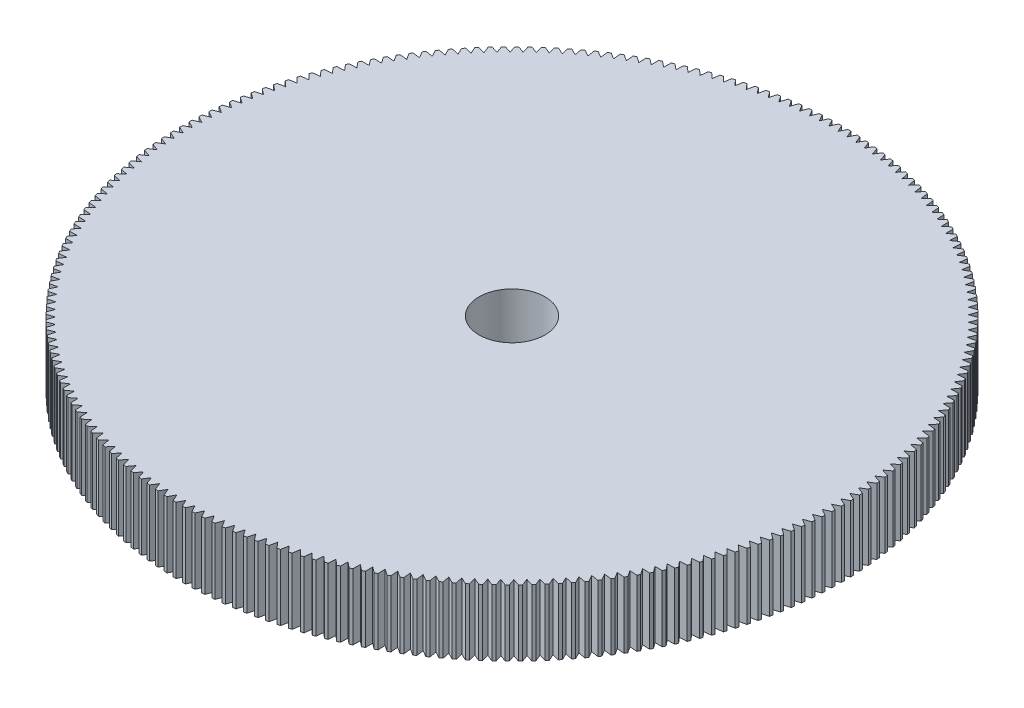
from build123d import *

# Parameters (mm, degrees)
Y_KSEKLIK_EKSTR_ZYON3_DEPTH = 5
IZIM3_R                     = 2.5
KES_EKSTR_ZYON1_DEPTH       = 10


with BuildPart() as part:
    # Çizim2 → Yükseklik-Ekstrüzyon3 (new body)
    with BuildSketch(Plane(origin=(0, 0, 0), x_dir=(1, 0, 0), z_dir=(0, 1, 0))):
        with BuildLine():
            Line((-15.953265986, 19.173059118), (-15.817862562, 18.633730827))
            Line((-15.817862562, 18.633730827), (-16.3280455, 18.854915054))
            ThreePointArc((-16.3280455, 18.854915054), (-16.411316906, 18.782480373), (-16.494266979, 18.709677933))
            Line((-16.494266979, 18.709677933), (-16.343517688, 18.174436171))
            Line((-16.343517688, 18.174436171), (-16.859808718, 18.380961388))
            ThreePointArc((-16.859808718, 18.380961388), (-16.940977717, 18.306178344), (-17.021815013, 18.231036867))
            Line((-17.021815013, 18.231036867), (-16.855842807, 17.700318184))
            Line((-16.855842807, 17.700318184), (-17.377820834, 17.892015946))
            ThreePointArc((-17.377820834, 17.892015946), (-17.456821223, 17.814945533), (-17.535479809, 17.737526305))
            Line((-17.535479809, 17.737526305), (-17.354420058, 17.211763564))
            Line((-17.354420058, 17.211763564), (-17.88165935, 17.388477519))
            ThreePointArc((-17.88165935, 17.388477519), (-17.958426696, 17.309182597), (-18.034842417, 17.229548763))
            Line((-18.034842417, 17.229548763), (-17.838842796, 16.709170783))
            Line((-17.838842796, 16.709170783), (-18.370913329, 16.870756801))
            ThreePointArc((-18.370913329, 16.870756801), (-18.445385018, 16.789302043), (-18.519495548, 16.707518553))
            Line((-18.519495548, 16.707518553), (-18.308715918, 16.192949762))
            Line((-18.308715918, 16.192949762), (-18.845183727, 16.339276051))
            ThreePointArc((-18.845183727, 16.339276051), (-18.91729902, 16.255727894), (-18.989043914, 16.171861451))
            Line((-18.989043914, 16.171861451), (-18.763656188, 15.66352154))
            Line((-18.763656188, 15.66352154), (-19.304083722, 15.794468753))
            ThreePointArc((-19.304083722, 15.794468753), (-19.373783801, 15.70889534), (-19.443104542, 15.623014348))
            Line((-19.443104542, 15.623014348), (-19.203292551, 15.121317924))
            Line((-19.203292551, 15.121317924), (-19.747239031, 15.23677926))
            ThreePointArc((-19.747239031, 15.23677926), (-19.814467046, 15.149250385), (-19.881307096, 15.06142489))
            Line((-19.881307096, 15.06142489), (-19.627266433, 14.566781145))
            Line((-19.627266433, 14.566781145), (-20.174288207, 14.666662432))
            ThreePointArc((-20.174288207, 14.666662432), (-20.238989328, 14.577249485), (-20.303294171, 14.487551117))
            Line((-20.303294171, 14.487551117), (-20.035232036, 14.00036349))
            Line((-20.035232036, 14.00036349), (-20.584882945, 14.084583263))
            ThreePointArc((-20.584882945, 14.084583263), (-20.647004399, 13.993359171), (-20.708721587, 13.90186109))
            Line((-20.708721587, 13.90186109), (-20.426856615, 13.422526937))
            Line((-20.426856615, 13.422526937), (-20.978688358, 13.491016506))
            ThreePointArc((-20.978688358, 13.491016506), (-21.038179478, 13.398055672), (-21.097258674, 13.304832506))
            Line((-21.097258674, 13.304832506), (-20.801820758, 12.83374278))
            Line((-20.801820758, 12.83374278), (-21.355383251, 12.886446282))
            ThreePointArc((-21.355383251, 12.886446282), (-21.412195516, 12.791824527), (-21.468588533, 12.69695231))
            Line((-21.468588533, 12.69695231), (-21.159818637, 12.234491237))
            Line((-21.159818637, 12.234491237), (-21.714660387, 12.271365688))
            ThreePointArc((-21.714660387, 12.271365688), (-21.76874746, 12.175160187), (-21.822408304, 12.078716297))
            Line((-21.822408304, 12.078716297), (-21.500558264, 11.625261068))
            Line((-21.500558264, 11.625261068), (-22.056226734, 11.646276392))
            ThreePointArc((-22.056226734, 11.646276392), (-22.107544502, 11.548565611), (-22.158429405, 11.45062871))
            Line((-22.158429405, 11.45062871), (-21.823761728, 11.006549169))
            Line((-21.823761728, 11.006549169), (-22.379803707, 11.011688226))
            ThreePointArc((-22.379803707, 11.011688226), (-22.428310313, 10.912551859), (-22.476377774, 10.813201826))
            Line((-22.476377774, 10.813201826), (-22.129165418, 10.378860171))
            Line((-22.129165418, 10.378860171), (-22.685127391, 10.368118769))
            ThreePointArc((-22.685127391, 10.368118769), (-22.730783272, 10.267637674), (-22.775994086, 10.166955539))
            Line((-22.775994086, 10.166955539), (-22.416520244, 9.742706026))
            Line((-22.416520244, 9.742706026), (-22.97194876, 9.716092926))
            ThreePointArc((-22.97194876, 9.716092926), (-23.014716678, 9.614349056), (-23.057033971, 9.512416938))
            Line((-23.057033971, 9.512416938), (-22.685591835, 9.09860559))
            Line((-22.685591835, 9.09860559), (-23.240033877, 9.056142498))
            ThreePointArc((-23.240033877, 9.056142498), (-23.279878952, 8.953218837), (-23.319268209, 8.850119873))
            Line((-23.319268209, 8.850119873), (-22.936160731, 8.4470842))
            Line((-22.936160731, 8.4470842), (-23.48916409, 8.38880575))
            ThreePointArc((-23.48916409, 8.38880575), (-23.526053822, 8.284786244), (-23.562482917, 8.180604523))
            Line((-23.562482917, 8.180604523), (-23.168022566, 7.788673248))
            Line((-23.168022566, 7.788673248), (-23.719136203, 7.714626972))
            ThreePointArc((-23.719136203, 7.714626972), (-23.753040506, 7.609596461), (-23.786479725, 7.504416955))
            Line((-23.786479725, 7.504416955), (-23.380988229, 7.123909742))
            Line((-23.380988229, 7.123909742), (-23.929762649, 7.034156034))
            ThreePointArc((-23.929762649, 7.034156034), (-23.960653868, 6.928200182), (-23.99107594, 6.822108676))
            Line((-23.99107594, 6.822108676), (-23.574884022, 6.453335873))
            Line((-23.574884022, 6.453335873), (-24.120871637, 6.347947937))
            ThreePointArc((-24.120871637, 6.347947937), (-24.148724578, 6.241153163), (-24.176104689, 6.134236188))
            Line((-24.176104689, 6.134236188), (-23.749551803, 5.777498571))
            Line((-23.749551803, 5.777498571), (-24.292307297, 5.656562363))
            ThreePointArc((-24.292307297, 5.656562363), (-24.317099242, 5.549015771), (-24.34141506, 5.441360529))
            Line((-24.34141506, 5.441360529), (-23.904849108, 5.096949058))
            Line((-23.904849108, 5.096949058), (-24.443929802, 4.960563215))
            ThreePointArc((-24.443929802, 4.960563215), (-24.465640531, 4.852352521), (-24.486872225, 4.744046819))
            Line((-24.486872225, 4.744046819), (-24.040649275, 4.4122424))
            Line((-24.040649275, 4.4122424), (-24.575615487, 4.260518161))
            ThreePointArc((-24.575615487, 4.260518161), (-24.594227292, 4.151731623), (-24.612357544, 4.042863795))
            Line((-24.612357544, 4.042863795), (-24.156841544, 3.723937054))
            Line((-24.156841544, 3.723937054), (-24.687256948, 3.556998167))
            ThreePointArc((-24.687256948, 3.556998167), (-24.702754649, 3.447724514), (-24.717768672, 3.338383354))
            Line((-24.717768672, 3.338383354), (-24.253331146, 3.032594412))
            Line((-24.253331146, 3.032594412), (-24.778763128, 2.850577034))
            ThreePointArc((-24.778763128, 2.850577034), (-24.791134085, 2.74090539), (-24.803019634, 2.63118008))
            Line((-24.803019634, 2.63118008), (-24.330039384, 2.338778342))
            Line((-24.330039384, 2.338778342), (-24.850059393, 2.14183093))
            ThreePointArc((-24.850059393, 2.14183093), (-24.859293516, 2.031850745), (-24.868040896, 1.921830777))
            Line((-24.868040896, 1.921830777), (-24.386903693, 1.643054731))
            Line((-24.386903693, 1.643054731), (-24.901087593, 1.431337917))
            ThreePointArc((-24.901087593, 1.431337917), (-24.907177351, 1.321138894), (-24.912779428, 1.210914002))
            Line((-24.912779428, 1.210914002), (-24.423877693, 0.945991021))
            Line((-24.423877693, 0.945991021), (-24.931806109, 0.719677485))
            ThreePointArc((-24.931806109, 0.719677485), (-24.934746535, 0.609349502), (-24.93719874, 0.499009588))
            Line((-24.93719874, 0.499009588), (-24.440931228, 0.248155747))
            Line((-24.440931228, 0.248155747), (-24.942189887, 0.007430074))
            ThreePointArc((-24.942189887, 0.007430074), (-24.941978581, -0.102936884), (-24.941278914, -0.213301826))
            Line((-24.941278914, -0.213301826), (-24.438050389, -0.449881926))
            Line((-24.438050389, -0.449881926), (-24.932230456, -0.704823397))
            ThreePointArc((-24.932230456, -0.704823397), (-24.928867593, -0.815139312), (-24.925016624, -0.925439267))
            Line((-24.925016624, -0.925439267), (-24.415237526, -1.147552669))
            Line((-24.415237526, -1.147552669), (-24.901935941, -1.416502005))
            ThreePointArc((-24.901935941, -1.416502005), (-24.895424262, -1.526676902), (-24.888425133, -1.636821907))
            Line((-24.888425133, -1.636821907), (-24.372511244, -1.844287452))
            Line((-24.372511244, -1.844287452), (-24.85133105, -2.127025292))
            ThreePointArc((-24.85133105, -2.127025292), (-24.841675866, -2.236969312), (-24.831534285, -2.346869532))
            Line((-24.831534285, -2.346869532), (-24.309906393, -2.539518007))
            Line((-24.309906393, -2.539518007), (-24.780457057, -2.835813748))
            ThreePointArc((-24.780457057, -2.835813748), (-24.767666244, -2.945437218), (-24.754390482, -3.055003016))
            Line((-24.754390482, -3.055003016), (-24.227474034, -3.232677296))
            Line((-24.227474034, -3.232677296), (-24.689371767, -3.542289273))
            ThreePointArc((-24.689371767, -3.542289273), (-24.673455757, -3.651502783), (-24.657056643, -3.760644796))
            Line((-24.657056643, -3.760644796), (-24.125281399, -3.923199966))
            Line((-24.125281399, -3.923199966), (-24.578149472, -4.245875657))
            ThreePointArc((-24.578149472, -4.245875657), (-24.559121246, -4.354590129), (-24.539612154, -4.46321934))
            Line((-24.539612154, -4.46321934), (-24.003411839, -4.610522818))
            Line((-24.003411839, -4.610522818), (-24.446880885, -4.945999043))
            ThreePointArc((-24.446880885, -4.945999043), (-24.424755963, -5.05412581), (-24.402152806, -5.162153618))
            Line((-24.402152806, -5.162153618), (-23.861964752, -5.294085261))
            Line((-23.861964752, -5.294085261), (-24.295673072, -5.642088401))
            ThreePointArc((-24.295673072, -5.642088401), (-24.270469499, -5.749539273), (-24.244790712, -5.85687757))
            Line((-24.244790712, -5.85687757), (-23.701055504, -5.973329773))
            Line((-23.701055504, -5.973329773), (-24.12464936, -6.333575991))
            ThreePointArc((-24.12464936, -6.333575991), (-24.096387692, -6.44026333), (-24.06765422, -6.546824568))
            Line((-24.06765422, -6.546824568), (-23.520815335, -6.647702351))
            Line((-23.520815335, -6.647702351), (-23.933949237, -7.019897826))
            ThreePointArc((-23.933949237, -7.019897826), (-23.902652526, -7.125734615), (-23.870887803, -7.231431883))
            Line((-23.870887803, -7.231431883), (-23.321391252, -7.316652967))
            Line((-23.321391252, -7.316652967), (-23.723728242, -7.700494132))
            ThreePointArc((-23.723728242, -7.700494132), (-23.689422013, -7.805394049), (-23.654651947, -7.910141137))
            Line((-23.654651947, -7.910141137), (-23.102945907, -7.979636017))
            Line((-23.102945907, -7.979636017), (-23.494157834, -8.374809803))
            ThreePointArc((-23.494157834, -8.374809803), (-23.456870068, -8.478687291), (-23.419123018, -8.582398768))
            Line((-23.419123018, -8.582398768), (-22.865657469, -8.636110761))
            Line((-22.865657469, -8.636110761), (-23.245425253, -9.04229486))
            ThreePointArc((-23.245425253, -9.04229486), (-23.205186363, -9.145065195), (-23.164493117, -9.24765647))
            Line((-23.164493117, -9.24765647), (-22.609719472, -9.285541769))
            Line((-22.609719472, -9.285541769), (-22.977733371, -9.702404892))
            ThreePointArc((-22.977733371, -9.702404892), (-22.934576175, -9.803984252), (-22.890969923, -9.905371652))
            Line((-22.890969923, -9.905371652), (-22.335340664, -9.927399356))
            Line((-22.335340664, -9.927399356), (-22.69130052, -10.354601503))
            ThreePointArc((-22.69130052, -10.354601503), (-22.645260218, -10.454907039), (-22.598776525, -10.55500787))
            Line((-22.598776525, -10.55500787), (-22.042744832, -10.561160014))
            Line((-22.042744832, -10.561160014), (-22.386360318, -10.998352752))
            ThreePointArc((-22.386360318, -10.998352752), (-22.337474462, -11.097302654), (-22.288151241, -11.196035272))
            Line((-22.288151241, -11.196035272), (-21.73217062, -11.186306839))
            Line((-21.73217062, -11.186306839), (-22.06316148, -11.633133588))
            ThreePointArc((-22.06316148, -11.633133588), (-22.011469942, -11.73064715), (-21.959347421, -11.827931028))
            Line((-21.959347421, -11.827931028), (-21.403871339, -11.80232995))
            Line((-21.403871339, -11.80232995), (-21.721967611, -12.258426272))
            ThreePointArc((-21.721967611, -12.258426272), (-21.667512551, -12.354423962), (-21.612633242, -12.450179753))
            Line((-21.612633242, -12.450179753), (-21.058114753, -12.408726913))
            Line((-21.058114753, -12.408726913), (-21.363056993, -12.873720809))
            ThreePointArc((-21.363056993, -12.873720809), (-21.305882825, -12.968124328), (-21.24829149, -13.062273933))
            Line((-21.24829149, -13.062273933), (-20.695182867, -13.00500314))
            Line((-20.695182867, -13.00500314), (-20.98672236, -13.478515353))
            ThreePointArc((-20.98672236, -13.478515353), (-20.926875717, -13.571247706), (-20.866619327, -13.663714335))
            Line((-20.866619327, -13.663714335), (-20.315371693, -13.590672299))
            Line((-20.315371693, -13.590672299), (-20.593270655, -14.072316628))
            ThreePointArc((-20.593270655, -14.072316628), (-20.530800348, -14.16330218), (-20.467928049, -14.254010416))
            Line((-20.467928049, -14.254010416), (-19.91899101, -14.165256711))
            Line((-19.91899101, -14.165256711), (-20.183022783, -14.654640319))
            ThreePointArc((-20.183022783, -14.654640319), (-20.117979764, -14.743804861), (-20.052542836, -14.832680721))
            Line((-20.052542836, -14.832680721), (-19.506364113, -14.728287737))
            Line((-19.506364113, -14.728287737), (-19.756313349, -15.225011475))
            ThreePointArc((-19.756313349, -15.225011475), (-19.688750667, -15.312282284), (-19.620802481, -15.399253279))
            Line((-19.620802481, -15.399253279), (-19.077827545, -15.27930616))
            Line((-19.077827545, -15.27930616), (-19.313490381, -15.782964894))
            ThreePointArc((-19.313490381, -15.782964894), (-19.243463142, -15.868270789), (-19.173059118, -15.953265986))
            Line((-19.173059118, -15.953265986), (-18.633730827, -15.817862562))
            Line((-18.633730827, -15.817862562), (-18.854915054, -16.3280455))
            ThreePointArc((-18.854915054, -16.3280455), (-18.782480373, -16.411316906), (-18.709677933, -16.494266979))
            Line((-18.709677933, -16.494266979), (-18.174436171, -16.343517688))
            Line((-18.174436171, -16.343517688), (-18.380961388, -16.859808718))
            ThreePointArc((-18.380961388, -16.859808718), (-18.306178344, -16.940977717), (-18.231036867, -17.021815013))
            Line((-18.231036867, -17.021815013), (-17.700318184, -16.855842807))
            Line((-17.700318184, -16.855842807), (-17.892015946, -17.377820834))
            ThreePointArc((-17.892015946, -17.377820834), (-17.814945533, -17.456821223), (-17.737526305, -17.535479809))
            Line((-17.737526305, -17.535479809), (-17.211763564, -17.354420058))
            Line((-17.211763564, -17.354420058), (-17.388477519, -17.88165935))
            ThreePointArc((-17.388477519, -17.88165935), (-17.309182597, -17.958426696), (-17.229548763, -18.034842417))
            Line((-17.229548763, -18.034842417), (-16.709170783, -17.838842796))
            Line((-16.709170783, -17.838842796), (-16.870756801, -18.370913329))
            ThreePointArc((-16.870756801, -18.370913329), (-16.789302043, -18.445385018), (-16.707518553, -18.519495548))
            Line((-16.707518553, -18.519495548), (-16.192949762, -18.308715918))
            Line((-16.192949762, -18.308715918), (-16.339276051, -18.845183727))
            ThreePointArc((-16.339276051, -18.845183727), (-16.255727894, -18.91729902), (-16.171861451, -18.989043914))
            Line((-16.171861451, -18.989043914), (-15.66352154, -18.763656188))
            Line((-15.66352154, -18.763656188), (-15.794468753, -19.304083722))
            ThreePointArc((-15.794468753, -19.304083722), (-15.70889534, -19.373783801), (-15.623014348, -19.443104542))
            Line((-15.623014348, -19.443104542), (-15.121317924, -19.203292551))
            Line((-15.121317924, -19.203292551), (-15.23677926, -19.747239031))
            ThreePointArc((-15.23677926, -19.747239031), (-15.149250385, -19.814467046), (-15.06142489, -19.881307096))
            Line((-15.06142489, -19.881307096), (-14.566781145, -19.627266433))
            Line((-14.566781145, -19.627266433), (-14.666662432, -20.174288207))
            ThreePointArc((-14.666662432, -20.174288207), (-14.577249485, -20.238989328), (-14.487551117, -20.303294171))
            Line((-14.487551117, -20.303294171), (-14.00036349, -20.035232036))
            Line((-14.00036349, -20.035232036), (-14.084583263, -20.584882945))
            ThreePointArc((-14.084583263, -20.584882945), (-13.993359171, -20.647004399), (-13.90186109, -20.708721587))
            Line((-13.90186109, -20.708721587), (-13.422526937, -20.426856615))
            Line((-13.422526937, -20.426856615), (-13.491016506, -20.978688358))
            ThreePointArc((-13.491016506, -20.978688358), (-13.398055672, -21.038179478), (-13.304832506, -21.097258674))
            Line((-13.304832506, -21.097258674), (-12.83374278, -20.801820758))
            Line((-12.83374278, -20.801820758), (-12.886446282, -21.355383251))
            ThreePointArc((-12.886446282, -21.355383251), (-12.791824527, -21.412195516), (-12.69695231, -21.468588533))
            Line((-12.69695231, -21.468588533), (-12.234491237, -21.159818637))
            Line((-12.234491237, -21.159818637), (-12.271365688, -21.714660387))
            ThreePointArc((-12.271365688, -21.714660387), (-12.175160187, -21.76874746), (-12.078716297, -21.822408304))
            Line((-12.078716297, -21.822408304), (-11.625261068, -21.500558264))
            Line((-11.625261068, -21.500558264), (-11.646276392, -22.056226734))
            ThreePointArc((-11.646276392, -22.056226734), (-11.548565611, -22.107544502), (-11.45062871, -22.158429405))
            Line((-11.45062871, -22.158429405), (-11.006549169, -21.823761728))
            Line((-11.006549169, -21.823761728), (-11.011688226, -22.379803707))
            ThreePointArc((-11.011688226, -22.379803707), (-10.912551859, -22.428310313), (-10.813201826, -22.476377774))
            Line((-10.813201826, -22.476377774), (-10.378860171, -22.129165418))
            Line((-10.378860171, -22.129165418), (-10.368118769, -22.685127391))
            ThreePointArc((-10.368118769, -22.685127391), (-10.267637674, -22.730783272), (-10.166955539, -22.775994086))
            Line((-10.166955539, -22.775994086), (-9.742706026, -22.416520244))
            Line((-9.742706026, -22.416520244), (-9.716092926, -22.97194876))
            ThreePointArc((-9.716092926, -22.97194876), (-9.614349056, -23.014716678), (-9.512416938, -23.057033971))
            Line((-9.512416938, -23.057033971), (-9.09860559, -22.685591835))
            Line((-9.09860559, -22.685591835), (-9.056142498, -23.240033877))
            ThreePointArc((-9.056142498, -23.240033877), (-8.953218837, -23.279878952), (-8.850119873, -23.319268209))
            Line((-8.850119873, -23.319268209), (-8.4470842, -22.936160731))
            Line((-8.4470842, -22.936160731), (-8.38880575, -23.48916409))
            ThreePointArc((-8.38880575, -23.48916409), (-8.284786244, -23.526053822), (-8.180604523, -23.562482917))
            Line((-8.180604523, -23.562482917), (-7.788673248, -23.168022566))
            Line((-7.788673248, -23.168022566), (-7.714626972, -23.719136203))
            ThreePointArc((-7.714626972, -23.719136203), (-7.609596461, -23.753040506), (-7.504416955, -23.786479725))
            Line((-7.504416955, -23.786479725), (-7.123909742, -23.380988229))
            Line((-7.123909742, -23.380988229), (-7.034156034, -23.929762649))
            ThreePointArc((-7.034156034, -23.929762649), (-6.928200182, -23.960653868), (-6.822108676, -23.99107594))
            Line((-6.822108676, -23.99107594), (-6.453335873, -23.574884022))
            Line((-6.453335873, -23.574884022), (-6.347947937, -24.120871637))
            ThreePointArc((-6.347947937, -24.120871637), (-6.241153163, -24.148724578), (-6.134236188, -24.176104689))
            Line((-6.134236188, -24.176104689), (-5.777498571, -23.749551803))
            Line((-5.777498571, -23.749551803), (-5.656562363, -24.292307297))
            ThreePointArc((-5.656562363, -24.292307297), (-5.549015771, -24.317099242), (-5.441360529, -24.34141506))
            Line((-5.441360529, -24.34141506), (-5.096949058, -23.904849108))
            Line((-5.096949058, -23.904849108), (-4.960563215, -24.443929802))
            ThreePointArc((-4.960563215, -24.443929802), (-4.852352521, -24.465640531), (-4.744046819, -24.486872225))
            Line((-4.744046819, -24.486872225), (-4.4122424, -24.040649275))
            Line((-4.4122424, -24.040649275), (-4.260518161, -24.575615487))
            ThreePointArc((-4.260518161, -24.575615487), (-4.151731623, -24.594227292), (-4.042863795, -24.612357544))
            Line((-4.042863795, -24.612357544), (-3.723937054, -24.156841544))
            Line((-3.723937054, -24.156841544), (-3.556998167, -24.687256948))
            ThreePointArc((-3.556998167, -24.687256948), (-3.447724514, -24.702754649), (-3.338383354, -24.717768672))
            Line((-3.338383354, -24.717768672), (-3.032594412, -24.253331146))
            Line((-3.032594412, -24.253331146), (-2.850577034, -24.778763128))
            ThreePointArc((-2.850577034, -24.778763128), (-2.74090539, -24.791134085), (-2.63118008, -24.803019634))
            Line((-2.63118008, -24.803019634), (-2.338778342, -24.330039384))
            Line((-2.338778342, -24.330039384), (-2.14183093, -24.850059393))
            ThreePointArc((-2.14183093, -24.850059393), (-2.031850745, -24.859293516), (-1.921830777, -24.868040896))
            Line((-1.921830777, -24.868040896), (-1.643054731, -24.386903693))
            Line((-1.643054731, -24.386903693), (-1.431337917, -24.901087593))
            ThreePointArc((-1.431337917, -24.901087593), (-1.321138894, -24.907177351), (-1.210914002, -24.912779428))
            Line((-1.210914002, -24.912779428), (-0.945991021, -24.423877693))
            Line((-0.945991021, -24.423877693), (-0.719677485, -24.931806109))
            ThreePointArc((-0.719677485, -24.931806109), (-0.609349502, -24.934746535), (-0.499009588, -24.93719874))
            Line((-0.499009588, -24.93719874), (-0.248155747, -24.440931228))
            Line((-0.248155747, -24.440931228), (-0.007430074, -24.942189887))
            ThreePointArc((-0.007430074, -24.942189887), (0.102936884, -24.941978581), (0.213301826, -24.941278914))
            Line((0.213301826, -24.941278914), (0.449881926, -24.438050389))
            Line((0.449881926, -24.438050389), (0.704823397, -24.932230456))
            ThreePointArc((0.704823397, -24.932230456), (0.815139312, -24.928867593), (0.925439267, -24.925016624))
            Line((0.925439267, -24.925016624), (1.147552669, -24.415237526))
            Line((1.147552669, -24.415237526), (1.416502005, -24.901935941))
            ThreePointArc((1.416502005, -24.901935941), (1.526676902, -24.895424262), (1.636821907, -24.888425133))
            Line((1.636821907, -24.888425133), (1.844287452, -24.372511244))
            Line((1.844287452, -24.372511244), (2.127025292, -24.85133105))
            ThreePointArc((2.127025292, -24.85133105), (2.236969312, -24.841675866), (2.346869532, -24.831534285))
            Line((2.346869532, -24.831534285), (2.539518007, -24.309906393))
            Line((2.539518007, -24.309906393), (2.835813748, -24.780457057))
            ThreePointArc((2.835813748, -24.780457057), (2.945437218, -24.767666244), (3.055003016, -24.754390482))
            Line((3.055003016, -24.754390482), (3.232677296, -24.227474034))
            Line((3.232677296, -24.227474034), (3.542289273, -24.689371767))
            ThreePointArc((3.542289273, -24.689371767), (3.651502783, -24.673455757), (3.760644796, -24.657056643))
            Line((3.760644796, -24.657056643), (3.923199966, -24.125281399))
            Line((3.923199966, -24.125281399), (4.245875657, -24.578149472))
            ThreePointArc((4.245875657, -24.578149472), (4.354590129, -24.559121246), (4.46321934, -24.539612154))
            Line((4.46321934, -24.539612154), (4.610522818, -24.003411839))
            Line((4.610522818, -24.003411839), (4.945999043, -24.446880885))
            ThreePointArc((4.945999043, -24.446880885), (5.05412581, -24.424755963), (5.162153618, -24.402152806))
            Line((5.162153618, -24.402152806), (5.294085261, -23.861964752))
            Line((5.294085261, -23.861964752), (5.642088401, -24.295673072))
            ThreePointArc((5.642088401, -24.295673072), (5.749539273, -24.270469499), (5.85687757, -24.244790712))
            Line((5.85687757, -24.244790712), (5.973329773, -23.701055504))
            Line((5.973329773, -23.701055504), (6.333575991, -24.12464936))
            ThreePointArc((6.333575991, -24.12464936), (6.44026333, -24.096387692), (6.546824568, -24.06765422))
            Line((6.546824568, -24.06765422), (6.647702351, -23.520815335))
            Line((6.647702351, -23.520815335), (7.019897826, -23.933949237))
            ThreePointArc((7.019897826, -23.933949237), (7.125734615, -23.902652526), (7.231431883, -23.870887803))
            Line((7.231431883, -23.870887803), (7.316652967, -23.321391252))
            Line((7.316652967, -23.321391252), (7.700494132, -23.723728242))
            ThreePointArc((7.700494132, -23.723728242), (7.805394049, -23.689422013), (7.910141137, -23.654651947))
            Line((7.910141137, -23.654651947), (7.979636017, -23.102945907))
            Line((7.979636017, -23.102945907), (8.374809803, -23.494157834))
            ThreePointArc((8.374809803, -23.494157834), (8.478687291, -23.456870068), (8.582398768, -23.419123018))
            Line((8.582398768, -23.419123018), (8.636110761, -22.865657469))
            Line((8.636110761, -22.865657469), (9.04229486, -23.245425253))
            ThreePointArc((9.04229486, -23.245425253), (9.145065195, -23.205186363), (9.24765647, -23.164493117))
            Line((9.24765647, -23.164493117), (9.285541769, -22.609719472))
            Line((9.285541769, -22.609719472), (9.702404892, -22.977733371))
            ThreePointArc((9.702404892, -22.977733371), (9.803984252, -22.934576175), (9.905371652, -22.890969923))
            Line((9.905371652, -22.890969923), (9.927399356, -22.335340664))
            Line((9.927399356, -22.335340664), (10.354601503, -22.69130052))
            ThreePointArc((10.354601503, -22.69130052), (10.454907039, -22.645260218), (10.55500787, -22.598776525))
            Line((10.55500787, -22.598776525), (10.561160014, -22.042744832))
            Line((10.561160014, -22.042744832), (10.998352752, -22.386360318))
            ThreePointArc((10.998352752, -22.386360318), (11.097302654, -22.337474462), (11.196035272, -22.288151241))
            Line((11.196035272, -22.288151241), (11.186306839, -21.73217062))
            Line((11.186306839, -21.73217062), (11.633133588, -22.06316148))
            ThreePointArc((11.633133588, -22.06316148), (11.73064715, -22.011469942), (11.827931028, -21.959347421))
            Line((11.827931028, -21.959347421), (11.80232995, -21.403871339))
            Line((11.80232995, -21.403871339), (12.258426272, -21.721967611))
            ThreePointArc((12.258426272, -21.721967611), (12.354423962, -21.667512551), (12.450179753, -21.612633242))
            Line((12.450179753, -21.612633242), (12.408726913, -21.058114753))
            Line((12.408726913, -21.058114753), (12.873720809, -21.363056993))
            ThreePointArc((12.873720809, -21.363056993), (12.968124328, -21.305882825), (13.062273933, -21.24829149))
            Line((13.062273933, -21.24829149), (13.00500314, -20.695182867))
            Line((13.00500314, -20.695182867), (13.478515353, -20.98672236))
            ThreePointArc((13.478515353, -20.98672236), (13.571247706, -20.926875717), (13.663714335, -20.866619327))
            Line((13.663714335, -20.866619327), (13.590672299, -20.315371693))
            Line((13.590672299, -20.315371693), (14.072316628, -20.593270655))
            ThreePointArc((14.072316628, -20.593270655), (14.16330218, -20.530800348), (14.254010416, -20.467928049))
            Line((14.254010416, -20.467928049), (14.165256711, -19.91899101))
            Line((14.165256711, -19.91899101), (14.654640319, -20.183022783))
            ThreePointArc((14.654640319, -20.183022783), (14.743804861, -20.117979764), (14.832680721, -20.052542836))
            Line((14.832680721, -20.052542836), (14.728287737, -19.506364113))
            Line((14.728287737, -19.506364113), (15.225011475, -19.756313349))
            ThreePointArc((15.225011475, -19.756313349), (15.312282284, -19.688750667), (15.399253279, -19.620802481))
            Line((15.399253279, -19.620802481), (15.27930616, -19.077827545))
            Line((15.27930616, -19.077827545), (15.782964894, -19.313490381))
            ThreePointArc((15.782964894, -19.313490381), (15.868270789, -19.243463142), (15.953265986, -19.173059118))
            Line((15.953265986, -19.173059118), (15.817862562, -18.633730827))
            Line((15.817862562, -18.633730827), (16.3280455, -18.854915054))
            ThreePointArc((16.3280455, -18.854915054), (16.411316906, -18.782480373), (16.494266979, -18.709677933))
            Line((16.494266979, -18.709677933), (16.343517688, -18.174436171))
            Line((16.343517688, -18.174436171), (16.859808718, -18.380961388))
            ThreePointArc((16.859808718, -18.380961388), (16.940977717, -18.306178344), (17.021815013, -18.231036867))
            Line((17.021815013, -18.231036867), (16.855842807, -17.700318184))
            Line((16.855842807, -17.700318184), (17.377820834, -17.892015946))
            ThreePointArc((17.377820834, -17.892015946), (17.456821223, -17.814945533), (17.535479809, -17.737526305))
            Line((17.535479809, -17.737526305), (17.354420058, -17.211763564))
            Line((17.354420058, -17.211763564), (17.88165935, -17.388477519))
            ThreePointArc((17.88165935, -17.388477519), (17.958426696, -17.309182597), (18.034842417, -17.229548763))
            Line((18.034842417, -17.229548763), (17.838842796, -16.709170783))
            Line((17.838842796, -16.709170783), (18.370913329, -16.870756801))
            ThreePointArc((18.370913329, -16.870756801), (18.445385018, -16.789302043), (18.519495548, -16.707518553))
            Line((18.519495548, -16.707518553), (18.308715918, -16.192949762))
            Line((18.308715918, -16.192949762), (18.845183727, -16.339276051))
            ThreePointArc((18.845183727, -16.339276051), (18.91729902, -16.255727894), (18.989043914, -16.171861451))
            Line((18.989043914, -16.171861451), (18.763656188, -15.66352154))
            Line((18.763656188, -15.66352154), (19.304083722, -15.794468753))
            ThreePointArc((19.304083722, -15.794468753), (19.373783801, -15.70889534), (19.443104542, -15.623014348))
            Line((19.443104542, -15.623014348), (19.203292551, -15.121317924))
            Line((19.203292551, -15.121317924), (19.747239031, -15.23677926))
            ThreePointArc((19.747239031, -15.23677926), (19.814467046, -15.149250385), (19.881307096, -15.06142489))
            Line((19.881307096, -15.06142489), (19.627266433, -14.566781145))
            Line((19.627266433, -14.566781145), (20.174288207, -14.666662432))
            ThreePointArc((20.174288207, -14.666662432), (20.238989328, -14.577249485), (20.303294171, -14.487551117))
            Line((20.303294171, -14.487551117), (20.035232036, -14.00036349))
            Line((20.035232036, -14.00036349), (20.584882945, -14.084583263))
            ThreePointArc((20.584882945, -14.084583263), (20.647004399, -13.993359171), (20.708721587, -13.90186109))
            Line((20.708721587, -13.90186109), (20.426856615, -13.422526937))
            Line((20.426856615, -13.422526937), (20.978688358, -13.491016506))
            ThreePointArc((20.978688358, -13.491016506), (21.038179478, -13.398055672), (21.097258674, -13.304832506))
            Line((21.097258674, -13.304832506), (20.801820758, -12.83374278))
            Line((20.801820758, -12.83374278), (21.355383251, -12.886446282))
            ThreePointArc((21.355383251, -12.886446282), (21.412195516, -12.791824527), (21.468588533, -12.69695231))
            Line((21.468588533, -12.69695231), (21.159818637, -12.234491237))
            Line((21.159818637, -12.234491237), (21.714660387, -12.271365688))
            ThreePointArc((21.714660387, -12.271365688), (21.76874746, -12.175160187), (21.822408304, -12.078716297))
            Line((21.822408304, -12.078716297), (21.500558264, -11.625261068))
            Line((21.500558264, -11.625261068), (22.056226734, -11.646276392))
            ThreePointArc((22.056226734, -11.646276392), (22.107544502, -11.548565611), (22.158429405, -11.45062871))
            Line((22.158429405, -11.45062871), (21.823761728, -11.006549169))
            Line((21.823761728, -11.006549169), (22.379803707, -11.011688226))
            ThreePointArc((22.379803707, -11.011688226), (22.428310313, -10.912551859), (22.476377774, -10.813201826))
            Line((22.476377774, -10.813201826), (22.129165418, -10.378860171))
            Line((22.129165418, -10.378860171), (22.685127391, -10.368118769))
            ThreePointArc((22.685127391, -10.368118769), (22.730783272, -10.267637674), (22.775994086, -10.166955539))
            Line((22.775994086, -10.166955539), (22.416520244, -9.742706026))
            Line((22.416520244, -9.742706026), (22.97194876, -9.716092926))
            ThreePointArc((22.97194876, -9.716092926), (23.014716678, -9.614349056), (23.057033971, -9.512416938))
            Line((23.057033971, -9.512416938), (22.685591835, -9.09860559))
            Line((22.685591835, -9.09860559), (23.240033877, -9.056142498))
            ThreePointArc((23.240033877, -9.056142498), (23.279878952, -8.953218837), (23.319268209, -8.850119873))
            Line((23.319268209, -8.850119873), (22.936160731, -8.4470842))
            Line((22.936160731, -8.4470842), (23.48916409, -8.38880575))
            ThreePointArc((23.48916409, -8.38880575), (23.526053822, -8.284786244), (23.562482917, -8.180604523))
            Line((23.562482917, -8.180604523), (23.168022566, -7.788673248))
            Line((23.168022566, -7.788673248), (23.719136203, -7.714626972))
            ThreePointArc((23.719136203, -7.714626972), (23.753040506, -7.609596461), (23.786479725, -7.504416955))
            Line((23.786479725, -7.504416955), (23.380988229, -7.123909742))
            Line((23.380988229, -7.123909742), (23.929762649, -7.034156034))
            ThreePointArc((23.929762649, -7.034156034), (23.960653868, -6.928200182), (23.99107594, -6.822108676))
            Line((23.99107594, -6.822108676), (23.574884022, -6.453335873))
            Line((23.574884022, -6.453335873), (24.120871637, -6.347947937))
            ThreePointArc((24.120871637, -6.347947937), (24.148724578, -6.241153163), (24.176104689, -6.134236188))
            Line((24.176104689, -6.134236188), (23.749551803, -5.777498571))
            Line((23.749551803, -5.777498571), (24.292307297, -5.656562363))
            ThreePointArc((24.292307297, -5.656562363), (24.317099242, -5.549015771), (24.34141506, -5.441360529))
            Line((24.34141506, -5.441360529), (23.904849108, -5.096949058))
            Line((23.904849108, -5.096949058), (24.443929802, -4.960563215))
            ThreePointArc((24.443929802, -4.960563215), (24.465640531, -4.852352521), (24.486872225, -4.744046819))
            Line((24.486872225, -4.744046819), (24.040649275, -4.4122424))
            Line((24.040649275, -4.4122424), (24.575615487, -4.260518161))
            ThreePointArc((24.575615487, -4.260518161), (24.594227292, -4.151731623), (24.612357544, -4.042863795))
            Line((24.612357544, -4.042863795), (24.156841544, -3.723937054))
            Line((24.156841544, -3.723937054), (24.687256948, -3.556998167))
            ThreePointArc((24.687256948, -3.556998167), (24.702754649, -3.447724514), (24.717768672, -3.338383354))
            Line((24.717768672, -3.338383354), (24.253331146, -3.032594412))
            Line((24.253331146, -3.032594412), (24.778763128, -2.850577034))
            ThreePointArc((24.778763128, -2.850577034), (24.791134085, -2.74090539), (24.803019634, -2.63118008))
            Line((24.803019634, -2.63118008), (24.330039384, -2.338778342))
            Line((24.330039384, -2.338778342), (24.850059393, -2.14183093))
            ThreePointArc((24.850059393, -2.14183093), (24.859293516, -2.031850745), (24.868040896, -1.921830777))
            Line((24.868040896, -1.921830777), (24.386903693, -1.643054731))
            Line((24.386903693, -1.643054731), (24.901087593, -1.431337917))
            ThreePointArc((24.901087593, -1.431337917), (24.907177351, -1.321138894), (24.912779428, -1.210914002))
            Line((24.912779428, -1.210914002), (24.423877693, -0.945991021))
            Line((24.423877693, -0.945991021), (24.931806109, -0.719677485))
            ThreePointArc((24.931806109, -0.719677485), (24.934746535, -0.609349502), (24.93719874, -0.499009588))
            Line((24.93719874, -0.499009588), (24.440931228, -0.248155747))
            Line((24.440931228, -0.248155747), (24.942189887, -0.007430074))
            ThreePointArc((24.942189887, -0.007430074), (24.942190717, -0.003715037), (24.942190994, 0))
            ThreePointArc((24.942190994, 0), (24.941962973, 0.106651888), (24.941278914, 0.213301826))
            Line((24.941278914, 0.213301826), (24.438050389, 0.449881926))
            Line((24.438050389, 0.449881926), (24.932230456, 0.704823397))
            ThreePointArc((24.932230456, 0.704823397), (24.928867593, 0.815139312), (24.925016624, 0.925439267))
            Line((24.925016624, 0.925439267), (24.415237526, 1.147552669))
            Line((24.415237526, 1.147552669), (24.901935941, 1.416502005))
            ThreePointArc((24.901935941, 1.416502005), (24.895424262, 1.526676902), (24.888425133, 1.636821907))
            Line((24.888425133, 1.636821907), (24.372511244, 1.844287452))
            Line((24.372511244, 1.844287452), (24.85133105, 2.127025292))
            ThreePointArc((24.85133105, 2.127025292), (24.841675866, 2.236969312), (24.831534285, 2.346869532))
            Line((24.831534285, 2.346869532), (24.309906393, 2.539518007))
            Line((24.309906393, 2.539518007), (24.780457057, 2.835813748))
            ThreePointArc((24.780457057, 2.835813748), (24.767666244, 2.945437218), (24.754390482, 3.055003016))
            Line((24.754390482, 3.055003016), (24.227474034, 3.232677296))
            Line((24.227474034, 3.232677296), (24.689371767, 3.542289273))
            ThreePointArc((24.689371767, 3.542289273), (24.673455757, 3.651502783), (24.657056643, 3.760644796))
            Line((24.657056643, 3.760644796), (24.125281399, 3.923199966))
            Line((24.125281399, 3.923199966), (24.578149472, 4.245875657))
            ThreePointArc((24.578149472, 4.245875657), (24.559121246, 4.354590129), (24.539612154, 4.46321934))
            Line((24.539612154, 4.46321934), (24.003411839, 4.610522818))
            Line((24.003411839, 4.610522818), (24.446880885, 4.945999043))
            ThreePointArc((24.446880885, 4.945999043), (24.424755963, 5.05412581), (24.402152806, 5.162153618))
            Line((24.402152806, 5.162153618), (23.861964752, 5.294085261))
            Line((23.861964752, 5.294085261), (24.295673072, 5.642088401))
            ThreePointArc((24.295673072, 5.642088401), (24.270469499, 5.749539273), (24.244790712, 5.85687757))
            Line((24.244790712, 5.85687757), (23.701055504, 5.973329773))
            Line((23.701055504, 5.973329773), (24.12464936, 6.333575991))
            ThreePointArc((24.12464936, 6.333575991), (24.096387692, 6.44026333), (24.06765422, 6.546824568))
            Line((24.06765422, 6.546824568), (23.520815335, 6.647702351))
            Line((23.520815335, 6.647702351), (23.933949237, 7.019897826))
            ThreePointArc((23.933949237, 7.019897826), (23.902652526, 7.125734615), (23.870887803, 7.231431883))
            Line((23.870887803, 7.231431883), (23.321391252, 7.316652967))
            Line((23.321391252, 7.316652967), (23.723728242, 7.700494132))
            ThreePointArc((23.723728242, 7.700494132), (23.689422013, 7.805394049), (23.654651947, 7.910141137))
            Line((23.654651947, 7.910141137), (23.102945907, 7.979636017))
            Line((23.102945907, 7.979636017), (23.494157834, 8.374809804))
            ThreePointArc((23.494157834, 8.374809804), (23.456870068, 8.478687291), (23.419123018, 8.582398768))
            Line((23.419123018, 8.582398768), (22.865657469, 8.636110761))
            Line((22.865657469, 8.636110761), (23.245425253, 9.04229486))
            ThreePointArc((23.245425253, 9.04229486), (23.205186363, 9.145065195), (23.164493117, 9.24765647))
            Line((23.164493117, 9.24765647), (22.609719472, 9.285541769))
            Line((22.609719472, 9.285541769), (22.977733371, 9.702404892))
            ThreePointArc((22.977733371, 9.702404892), (22.934576175, 9.803984252), (22.890969923, 9.905371652))
            Line((22.890969923, 9.905371652), (22.335340664, 9.927399356))
            Line((22.335340664, 9.927399356), (22.69130052, 10.354601503))
            ThreePointArc((22.69130052, 10.354601503), (22.645260218, 10.454907039), (22.598776525, 10.55500787))
            Line((22.598776525, 10.55500787), (22.042744832, 10.561160014))
            Line((22.042744832, 10.561160014), (22.386360318, 10.998352752))
            ThreePointArc((22.386360318, 10.998352752), (22.337474462, 11.097302654), (22.288151241, 11.196035272))
            Line((22.288151241, 11.196035272), (21.73217062, 11.186306839))
            Line((21.73217062, 11.186306839), (22.06316148, 11.633133588))
            ThreePointArc((22.06316148, 11.633133588), (22.011469942, 11.73064715), (21.959347421, 11.827931028))
            Line((21.959347421, 11.827931028), (21.403871339, 11.802329951))
            Line((21.403871339, 11.802329951), (21.721967611, 12.258426272))
            ThreePointArc((21.721967611, 12.258426272), (21.667512551, 12.354423962), (21.612633242, 12.450179753))
            Line((21.612633242, 12.450179753), (21.058114753, 12.408726913))
            Line((21.058114753, 12.408726913), (21.363056993, 12.873720809))
            ThreePointArc((21.363056993, 12.873720809), (21.305882825, 12.968124328), (21.24829149, 13.062273933))
            Line((21.24829149, 13.062273933), (20.695182867, 13.00500314))
            Line((20.695182867, 13.00500314), (20.98672236, 13.478515353))
            ThreePointArc((20.98672236, 13.478515353), (20.926875717, 13.571247706), (20.866619327, 13.663714335))
            Line((20.866619327, 13.663714335), (20.315371693, 13.590672299))
            Line((20.315371693, 13.590672299), (20.593270655, 14.072316628))
            ThreePointArc((20.593270655, 14.072316628), (20.530800348, 14.16330218), (20.467928049, 14.254010416))
            Line((20.467928049, 14.254010416), (19.91899101, 14.165256711))
            Line((19.91899101, 14.165256711), (20.183022783, 14.654640319))
            ThreePointArc((20.183022783, 14.654640319), (20.117979764, 14.743804861), (20.052542836, 14.832680721))
            Line((20.052542836, 14.832680721), (19.506364113, 14.728287737))
            Line((19.506364113, 14.728287737), (19.756313349, 15.225011475))
            ThreePointArc((19.756313349, 15.225011475), (19.688750667, 15.312282284), (19.620802481, 15.399253279))
            Line((19.620802481, 15.399253279), (19.077827545, 15.27930616))
            Line((19.077827545, 15.27930616), (19.313490381, 15.782964894))
            ThreePointArc((19.313490381, 15.782964894), (19.243463142, 15.86827079), (19.173059118, 15.953265986))
            Line((19.173059118, 15.953265986), (18.633730827, 15.817862562))
            Line((18.633730827, 15.817862562), (18.854915054, 16.3280455))
            ThreePointArc((18.854915054, 16.3280455), (18.782480373, 16.411316906), (18.709677933, 16.494266979))
            Line((18.709677933, 16.494266979), (18.174436171, 16.343517688))
            Line((18.174436171, 16.343517688), (18.380961388, 16.859808718))
            ThreePointArc((18.380961388, 16.859808718), (18.306178344, 16.940977717), (18.231036867, 17.021815013))
            Line((18.231036867, 17.021815013), (17.700318184, 16.855842807))
            Line((17.700318184, 16.855842807), (17.892015946, 17.377820834))
            ThreePointArc((17.892015946, 17.377820834), (17.814945533, 17.456821223), (17.737526305, 17.535479809))
            Line((17.737526305, 17.535479809), (17.211763564, 17.354420058))
            Line((17.211763564, 17.354420058), (17.388477519, 17.88165935))
            ThreePointArc((17.388477519, 17.88165935), (17.309182597, 17.958426696), (17.229548763, 18.034842417))
            Line((17.229548763, 18.034842417), (16.709170783, 17.838842796))
            Line((16.709170783, 17.838842796), (16.870756801, 18.370913329))
            ThreePointArc((16.870756801, 18.370913329), (16.789302043, 18.445385018), (16.707518553, 18.519495548))
            Line((16.707518553, 18.519495548), (16.192949762, 18.308715918))
            Line((16.192949762, 18.308715918), (16.339276051, 18.845183727))
            ThreePointArc((16.339276051, 18.845183727), (16.255727894, 18.91729902), (16.171861451, 18.989043914))
            Line((16.171861451, 18.989043914), (15.66352154, 18.763656188))
            Line((15.66352154, 18.763656188), (15.794468753, 19.304083722))
            ThreePointArc((15.794468753, 19.304083722), (15.70889534, 19.373783801), (15.623014348, 19.443104542))
            Line((15.623014348, 19.443104542), (15.121317924, 19.203292551))
            Line((15.121317924, 19.203292551), (15.23677926, 19.747239031))
            ThreePointArc((15.23677926, 19.747239031), (15.149250385, 19.814467046), (15.06142489, 19.881307096))
            Line((15.06142489, 19.881307096), (14.566781145, 19.627266433))
            Line((14.566781145, 19.627266433), (14.666662432, 20.174288207))
            ThreePointArc((14.666662432, 20.174288207), (14.577249485, 20.238989328), (14.487551117, 20.303294171))
            Line((14.487551117, 20.303294171), (14.00036349, 20.035232036))
            Line((14.00036349, 20.035232036), (14.084583263, 20.584882945))
            ThreePointArc((14.084583263, 20.584882945), (13.993359171, 20.647004399), (13.90186109, 20.708721587))
            Line((13.90186109, 20.708721587), (13.422526937, 20.426856615))
            Line((13.422526937, 20.426856615), (13.491016506, 20.978688358))
            ThreePointArc((13.491016506, 20.978688358), (13.398055672, 21.038179478), (13.304832506, 21.097258674))
            Line((13.304832506, 21.097258674), (12.83374278, 20.801820758))
            Line((12.83374278, 20.801820758), (12.886446282, 21.355383251))
            ThreePointArc((12.886446282, 21.355383251), (12.791824527, 21.412195516), (12.69695231, 21.468588533))
            Line((12.69695231, 21.468588533), (12.234491237, 21.159818637))
            Line((12.234491237, 21.159818637), (12.271365688, 21.714660387))
            ThreePointArc((12.271365688, 21.714660387), (12.175160187, 21.76874746), (12.078716297, 21.822408304))
            Line((12.078716297, 21.822408304), (11.625261068, 21.500558264))
            Line((11.625261068, 21.500558264), (11.646276392, 22.056226734))
            ThreePointArc((11.646276392, 22.056226734), (11.548565611, 22.107544502), (11.45062871, 22.158429405))
            Line((11.45062871, 22.158429405), (11.006549169, 21.823761728))
            Line((11.006549169, 21.823761728), (11.011688226, 22.379803707))
            ThreePointArc((11.011688226, 22.379803707), (10.912551859, 22.428310313), (10.813201826, 22.476377774))
            Line((10.813201826, 22.476377774), (10.378860171, 22.129165418))
            Line((10.378860171, 22.129165418), (10.368118769, 22.685127391))
            ThreePointArc((10.368118769, 22.685127391), (10.267637674, 22.730783272), (10.166955539, 22.775994086))
            Line((10.166955539, 22.775994086), (9.742706026, 22.416520244))
            Line((9.742706026, 22.416520244), (9.716092926, 22.97194876))
            ThreePointArc((9.716092926, 22.97194876), (9.614349056, 23.014716678), (9.512416938, 23.057033971))
            Line((9.512416938, 23.057033971), (9.09860559, 22.685591835))
            Line((9.09860559, 22.685591835), (9.056142498, 23.240033877))
            ThreePointArc((9.056142498, 23.240033877), (8.953218837, 23.279878952), (8.850119873, 23.319268209))
            Line((8.850119873, 23.319268209), (8.4470842, 22.936160731))
            Line((8.4470842, 22.936160731), (8.38880575, 23.48916409))
            ThreePointArc((8.38880575, 23.48916409), (8.284786244, 23.526053822), (8.180604523, 23.562482917))
            Line((8.180604523, 23.562482917), (7.788673248, 23.168022566))
            Line((7.788673248, 23.168022566), (7.714626972, 23.719136203))
            ThreePointArc((7.714626972, 23.719136203), (7.609596461, 23.753040506), (7.504416955, 23.786479725))
            Line((7.504416955, 23.786479725), (7.123909742, 23.380988229))
            Line((7.123909742, 23.380988229), (7.034156034, 23.929762649))
            ThreePointArc((7.034156034, 23.929762649), (6.928200182, 23.960653868), (6.822108676, 23.99107594))
            Line((6.822108676, 23.99107594), (6.453335873, 23.574884022))
            Line((6.453335873, 23.574884022), (6.347947937, 24.120871637))
            ThreePointArc((6.347947937, 24.120871637), (6.241153163, 24.148724578), (6.134236188, 24.176104689))
            Line((6.134236188, 24.176104689), (5.777498571, 23.749551803))
            Line((5.777498571, 23.749551803), (5.656562363, 24.292307297))
            ThreePointArc((5.656562363, 24.292307297), (5.549015771, 24.317099242), (5.441360529, 24.34141506))
            Line((5.441360529, 24.34141506), (5.096949058, 23.904849108))
            Line((5.096949058, 23.904849108), (4.960563215, 24.443929802))
            ThreePointArc((4.960563215, 24.443929802), (4.852352521, 24.465640531), (4.744046819, 24.486872225))
            Line((4.744046819, 24.486872225), (4.4122424, 24.040649275))
            Line((4.4122424, 24.040649275), (4.260518161, 24.575615487))
            ThreePointArc((4.260518161, 24.575615487), (4.151731623, 24.594227292), (4.042863795, 24.612357544))
            Line((4.042863795, 24.612357544), (3.723937054, 24.156841544))
            Line((3.723937054, 24.156841544), (3.556998167, 24.687256948))
            ThreePointArc((3.556998167, 24.687256948), (3.447724514, 24.702754649), (3.338383354, 24.717768672))
            Line((3.338383354, 24.717768672), (3.032594412, 24.253331146))
            Line((3.032594412, 24.253331146), (2.850577034, 24.778763128))
            ThreePointArc((2.850577034, 24.778763128), (2.74090539, 24.791134085), (2.63118008, 24.803019634))
            Line((2.63118008, 24.803019634), (2.338778342, 24.330039384))
            Line((2.338778342, 24.330039384), (2.14183093, 24.850059393))
            ThreePointArc((2.14183093, 24.850059393), (2.031850745, 24.859293516), (1.921830777, 24.868040896))
            Line((1.921830777, 24.868040896), (1.643054731, 24.386903693))
            Line((1.643054731, 24.386903693), (1.431337917, 24.901087593))
            ThreePointArc((1.431337917, 24.901087593), (1.321138894, 24.907177351), (1.210914002, 24.912779428))
            Line((1.210914002, 24.912779428), (0.945991021, 24.423877693))
            Line((0.945991021, 24.423877693), (0.719677485, 24.931806109))
            ThreePointArc((0.719677485, 24.931806109), (0.609349502, 24.934746535), (0.499009588, 24.93719874))
            Line((0.499009588, 24.93719874), (0.248155747, 24.440931228))
            Line((0.248155747, 24.440931228), (0.007430074, 24.942189887))
            ThreePointArc((0.007430074, 24.942189887), (-0.102936884, 24.941978581), (-0.213301826, 24.941278914))
            Line((-0.213301826, 24.941278914), (-0.449881926, 24.438050389))
            Line((-0.449881926, 24.438050389), (-0.704823397, 24.932230456))
            ThreePointArc((-0.704823397, 24.932230456), (-0.815139312, 24.928867593), (-0.925439267, 24.925016624))
            Line((-0.925439267, 24.925016624), (-1.147552669, 24.415237526))
            Line((-1.147552669, 24.415237526), (-1.416502005, 24.901935941))
            ThreePointArc((-1.416502005, 24.901935941), (-1.526676902, 24.895424262), (-1.636821907, 24.888425133))
            Line((-1.636821907, 24.888425133), (-1.844287452, 24.372511244))
            Line((-1.844287452, 24.372511244), (-2.127025292, 24.85133105))
            ThreePointArc((-2.127025292, 24.85133105), (-2.236969312, 24.841675866), (-2.346869532, 24.831534285))
            Line((-2.346869532, 24.831534285), (-2.539518007, 24.309906393))
            Line((-2.539518007, 24.309906393), (-2.835813748, 24.780457057))
            ThreePointArc((-2.835813748, 24.780457057), (-2.945437218, 24.767666244), (-3.055003016, 24.754390482))
            Line((-3.055003016, 24.754390482), (-3.232677296, 24.227474034))
            Line((-3.232677296, 24.227474034), (-3.542289273, 24.689371767))
            ThreePointArc((-3.542289273, 24.689371767), (-3.651502783, 24.673455757), (-3.760644796, 24.657056643))
            Line((-3.760644796, 24.657056643), (-3.923199966, 24.125281399))
            Line((-3.923199966, 24.125281399), (-4.245875657, 24.578149472))
            ThreePointArc((-4.245875657, 24.578149472), (-4.354590129, 24.559121246), (-4.46321934, 24.539612154))
            Line((-4.46321934, 24.539612154), (-4.610522818, 24.003411839))
            Line((-4.610522818, 24.003411839), (-4.945999043, 24.446880885))
            ThreePointArc((-4.945999043, 24.446880885), (-5.05412581, 24.424755963), (-5.162153618, 24.402152806))
            Line((-5.162153618, 24.402152806), (-5.294085261, 23.861964752))
            Line((-5.294085261, 23.861964752), (-5.642088401, 24.295673072))
            ThreePointArc((-5.642088401, 24.295673072), (-5.749539273, 24.270469499), (-5.85687757, 24.244790712))
            Line((-5.85687757, 24.244790712), (-5.973329773, 23.701055504))
            Line((-5.973329773, 23.701055504), (-6.333575991, 24.12464936))
            ThreePointArc((-6.333575991, 24.12464936), (-6.44026333, 24.096387692), (-6.546824568, 24.06765422))
            Line((-6.546824568, 24.06765422), (-6.647702351, 23.520815335))
            Line((-6.647702351, 23.520815335), (-7.019897826, 23.933949237))
            ThreePointArc((-7.019897826, 23.933949237), (-7.125734615, 23.902652526), (-7.231431883, 23.870887803))
            Line((-7.231431883, 23.870887803), (-7.316652967, 23.321391252))
            Line((-7.316652967, 23.321391252), (-7.700494132, 23.723728242))
            ThreePointArc((-7.700494132, 23.723728242), (-7.805394049, 23.689422013), (-7.910141137, 23.654651947))
            Line((-7.910141137, 23.654651947), (-7.979636017, 23.102945907))
            Line((-7.979636017, 23.102945907), (-8.374809803, 23.494157834))
            ThreePointArc((-8.374809803, 23.494157834), (-8.478687291, 23.456870068), (-8.582398768, 23.419123018))
            Line((-8.582398768, 23.419123018), (-8.636110761, 22.865657469))
            Line((-8.636110761, 22.865657469), (-9.04229486, 23.245425253))
            ThreePointArc((-9.04229486, 23.245425253), (-9.145065195, 23.205186363), (-9.24765647, 23.164493117))
            Line((-9.24765647, 23.164493117), (-9.285541769, 22.609719472))
            Line((-9.285541769, 22.609719472), (-9.702404892, 22.977733371))
            ThreePointArc((-9.702404892, 22.977733371), (-9.803984252, 22.934576175), (-9.905371652, 22.890969923))
            Line((-9.905371652, 22.890969923), (-9.927399356, 22.335340664))
            Line((-9.927399356, 22.335340664), (-10.354601503, 22.69130052))
            ThreePointArc((-10.354601503, 22.69130052), (-10.454907039, 22.645260218), (-10.55500787, 22.598776525))
            Line((-10.55500787, 22.598776525), (-10.561160014, 22.042744832))
            Line((-10.561160014, 22.042744832), (-10.998352752, 22.386360318))
            ThreePointArc((-10.998352752, 22.386360318), (-11.097302654, 22.337474462), (-11.196035272, 22.288151241))
            Line((-11.196035272, 22.288151241), (-11.186306839, 21.73217062))
            Line((-11.186306839, 21.73217062), (-11.633133588, 22.06316148))
            ThreePointArc((-11.633133588, 22.06316148), (-11.73064715, 22.011469942), (-11.827931028, 21.959347421))
            Line((-11.827931028, 21.959347421), (-11.80232995, 21.403871339))
            Line((-11.80232995, 21.403871339), (-12.258426272, 21.721967611))
            ThreePointArc((-12.258426272, 21.721967611), (-12.354423962, 21.667512551), (-12.450179753, 21.612633242))
            Line((-12.450179753, 21.612633242), (-12.408726913, 21.058114753))
            Line((-12.408726913, 21.058114753), (-12.873720809, 21.363056993))
            ThreePointArc((-12.873720809, 21.363056993), (-12.968124328, 21.305882825), (-13.062273933, 21.24829149))
            Line((-13.062273933, 21.24829149), (-13.00500314, 20.695182867))
            Line((-13.00500314, 20.695182867), (-13.478515353, 20.98672236))
            ThreePointArc((-13.478515353, 20.98672236), (-13.571247706, 20.926875717), (-13.663714335, 20.866619327))
            Line((-13.663714335, 20.866619327), (-13.590672299, 20.315371693))
            Line((-13.590672299, 20.315371693), (-14.072316628, 20.593270655))
            ThreePointArc((-14.072316628, 20.593270655), (-14.16330218, 20.530800348), (-14.254010416, 20.467928049))
            Line((-14.254010416, 20.467928049), (-14.165256711, 19.91899101))
            Line((-14.165256711, 19.91899101), (-14.654640319, 20.183022783))
            ThreePointArc((-14.654640319, 20.183022783), (-14.743804861, 20.117979764), (-14.832680721, 20.052542836))
            Line((-14.832680721, 20.052542836), (-14.728287737, 19.506364113))
            Line((-14.728287737, 19.506364113), (-15.225011475, 19.756313349))
            ThreePointArc((-15.225011475, 19.756313349), (-15.312282284, 19.688750667), (-15.399253279, 19.620802481))
            Line((-15.399253279, 19.620802481), (-15.27930616, 19.077827545))
            Line((-15.27930616, 19.077827545), (-15.782964894, 19.313490381))
            ThreePointArc((-15.782964894, 19.313490381), (-15.868270789, 19.243463142), (-15.953265986, 19.173059118))
        make_face()
    extrude(amount=Y_KSEKLIK_EKSTR_ZYON3_DEPTH)

    # Çizim3 → Kes-Ekstrüzyon1 (cut)
    with BuildSketch(Plane(origin=(0, 5, 0), x_dir=(1, 0, 0), z_dir=(0, 1, 0))):
        Circle(IZIM3_R)
    extrude(amount=-KES_EKSTR_ZYON1_DEPTH, mode=Mode.SUBTRACT)


solid = part.part
